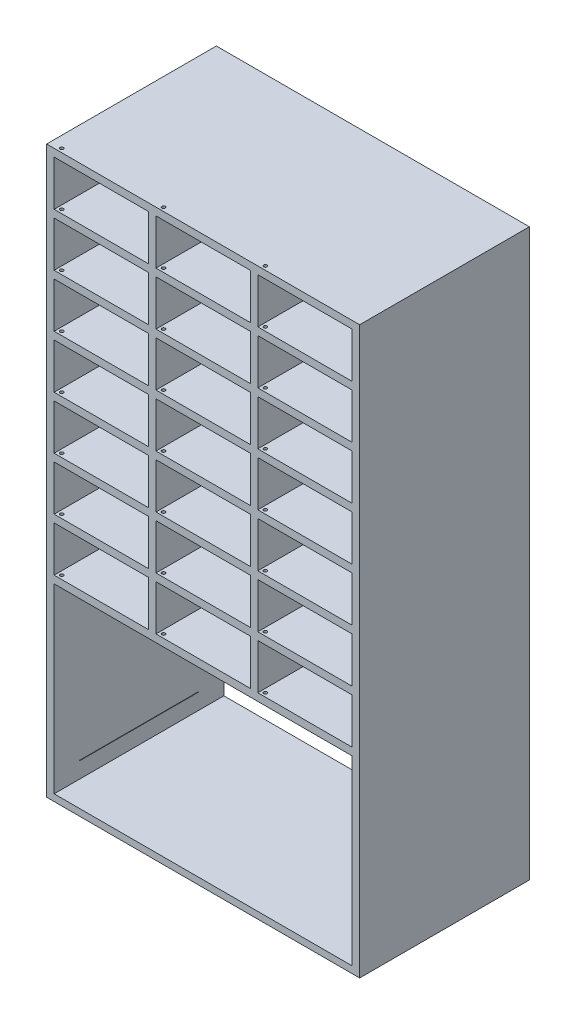
from build123d import *

# Parameters (mm, degrees)
SKETCH1_W                      = 560
SKETCH1_H                      = 450
BOSS_EXTRUDE1_DEPTH            = 20
SKETCH3_W                      = 20
SKETCH3_H                      = 450
BOSS_EXTRUDE2_DEPTH            = 120
LPATTERN2_COUNT                = 7
LPATTERN2_PITCH                = 140
LPATTERN5_COUNT                = 2
LPATTERN5_PITCH                = 270
LPATTERN5_COUNT_DIR2           = 14
LPATTERN5_PITCH_DIR2           = 140
SKETCH6_W                      = 450
SKETCH6_H                      = 1000
BOSS_EXTRUDE5_DEPTH            = 20
BOSS_EXTRUDE6_DEPTH            = 450
CUT_EXTRUDE1_REACH             = 1486.158
SKETCH10_R                     = 4.4
CUT_EXTRUDE1_DIRECTION_2_REACH = 1486.158
LPATTERN6_COUNT                = 3
LPATTERN6_PITCH                = 270
SKETCH13_W                     = 315
SKETCH13_H                     = 1.2
CUT_EXTRUDE3_DEPTH             = 20


with BuildPart() as part:
    # Sketch1 → Boss-Extrude1 (new body)
    with BuildSketch(Plane(origin=(0, 0, 0), x_dir=(1, 0, 0), z_dir=(0, 1, 0))):
        Rectangle(SKETCH1_W, SKETCH1_H)
    boss_extrude1 = extrude(amount=BOSS_EXTRUDE1_DEPTH)

    # Sketch3 → Boss-Extrude2 (add)
    with BuildSketch(Plane(origin=(0, 20, 0), x_dir=(1, 0, 0), z_dir=(0, 1, 0))):
        with Locations((-270, 0)):
            Rectangle(SKETCH3_W, SKETCH3_H)
        Rectangle(SKETCH3_W, SKETCH3_H)
        with Locations((270, 0)):
            Rectangle(SKETCH3_W, SKETCH3_H)
    extrude(amount=BOSS_EXTRUDE2_DEPTH)


with BuildPart() as lpattern2_1:
    # LPattern2: pattern copy
    add(part.part.moved(Location(Vector(0, 1, 0) * (1 * LPATTERN2_PITCH))))


with BuildPart() as lpattern2_2:
    # LPattern2: pattern copy
    add(part.part.moved(Location(Vector(0, 1, 0) * (2 * LPATTERN2_PITCH))))


with BuildPart() as lpattern2_3:
    # LPattern2: pattern copy
    add(part.part.moved(Location(Vector(0, 1, 0) * (3 * LPATTERN2_PITCH))))


with BuildPart() as lpattern2_4:
    # LPattern2: pattern copy
    add(part.part.moved(Location(Vector(0, 1, 0) * (4 * LPATTERN2_PITCH))))


with BuildPart() as lpattern2_5:
    # LPattern2: pattern copy
    add(part.part.moved(Location(Vector(0, 1, 0) * (5 * LPATTERN2_PITCH))))


with BuildPart() as lpattern2_6:
    # LPattern2: pattern copy
    add(part.part.moved(Location(Vector(0, 1, 0) * (6 * LPATTERN2_PITCH))))


with BuildPart() as lpattern5_1:
    # LPattern5: pattern copy
    add(boss_extrude1.moved(Location(Vector(1, 0, 0) * (0 * LPATTERN5_PITCH) + Vector(0, 1, 0) * (1 * LPATTERN5_PITCH_DIR2))))


with BuildPart() as lpattern5_2:
    # LPattern5: pattern copy
    add(boss_extrude1.moved(Location(Vector(1, 0, 0) * (0 * LPATTERN5_PITCH) + Vector(0, 1, 0) * (2 * LPATTERN5_PITCH_DIR2))))


with BuildPart() as lpattern5_3:
    # LPattern5: pattern copy
    add(boss_extrude1.moved(Location(Vector(1, 0, 0) * (0 * LPATTERN5_PITCH) + Vector(0, 1, 0) * (3 * LPATTERN5_PITCH_DIR2))))


with BuildPart() as lpattern5_4:
    # LPattern5: pattern copy
    add(boss_extrude1.moved(Location(Vector(1, 0, 0) * (0 * LPATTERN5_PITCH) + Vector(0, 1, 0) * (4 * LPATTERN5_PITCH_DIR2))))


with BuildPart() as lpattern5_5:
    # LPattern5: pattern copy
    add(boss_extrude1.moved(Location(Vector(1, 0, 0) * (0 * LPATTERN5_PITCH) + Vector(0, 1, 0) * (5 * LPATTERN5_PITCH_DIR2))))


with BuildPart() as lpattern5_6:
    # LPattern5: pattern copy
    add(boss_extrude1.moved(Location(Vector(1, 0, 0) * (0 * LPATTERN5_PITCH) + Vector(0, 1, 0) * (6 * LPATTERN5_PITCH_DIR2))))


with BuildPart() as lpattern5_7:
    # LPattern5: pattern copy
    add(boss_extrude1.moved(Location(Vector(1, 0, 0) * (0 * LPATTERN5_PITCH) + Vector(0, 1, 0) * (7 * LPATTERN5_PITCH_DIR2))))


with BuildPart() as lpattern5_8:
    # LPattern5: pattern copy
    add(boss_extrude1.moved(Location(Vector(1, 0, 0) * (1 * LPATTERN5_PITCH) + Vector(0, 1, 0) * (0 * LPATTERN5_PITCH_DIR2))))


with BuildPart() as lpattern5_9:
    # LPattern5: pattern copy
    add(boss_extrude1.moved(Location(Vector(1, 0, 0) * (1 * LPATTERN5_PITCH) + Vector(0, 1, 0) * (1 * LPATTERN5_PITCH_DIR2))))


with BuildPart() as lpattern5_10:
    # LPattern5: pattern copy
    add(boss_extrude1.moved(Location(Vector(1, 0, 0) * (1 * LPATTERN5_PITCH) + Vector(0, 1, 0) * (2 * LPATTERN5_PITCH_DIR2))))


with BuildPart() as lpattern5_11:
    # LPattern5: pattern copy
    add(boss_extrude1.moved(Location(Vector(1, 0, 0) * (1 * LPATTERN5_PITCH) + Vector(0, 1, 0) * (3 * LPATTERN5_PITCH_DIR2))))


with BuildPart() as lpattern5_12:
    # LPattern5: pattern copy
    add(boss_extrude1.moved(Location(Vector(1, 0, 0) * (1 * LPATTERN5_PITCH) + Vector(0, 1, 0) * (4 * LPATTERN5_PITCH_DIR2))))


with BuildPart() as lpattern5_13:
    # LPattern5: pattern copy
    add(boss_extrude1.moved(Location(Vector(1, 0, 0) * (1 * LPATTERN5_PITCH) + Vector(0, 1, 0) * (5 * LPATTERN5_PITCH_DIR2))))


with BuildPart() as lpattern5_14:
    # LPattern5: pattern copy
    add(boss_extrude1.moved(Location(Vector(1, 0, 0) * (1 * LPATTERN5_PITCH) + Vector(0, 1, 0) * (6 * LPATTERN5_PITCH_DIR2))))


with BuildPart() as lpattern5_15:
    # LPattern5: pattern copy
    add(boss_extrude1.moved(Location(Vector(1, 0, 0) * (1 * LPATTERN5_PITCH) + Vector(0, 1, 0) * (7 * LPATTERN5_PITCH_DIR2))))


with BuildPart() as part_1:
    add(part.part)

    # LPattern5 united with what the copies to: union LPattern2_1, LPattern2_2, LPattern2_3, LPattern2_4, LPattern2_5, LPattern2_6, LPattern5_1, LPattern5_2, LPattern5_3, LPattern5_4, LPattern5_5, LPattern5_6, LPattern5_7, LPattern5_8, LPattern5_9, LPattern5_10, LPattern5_11, LPattern5_12, LPattern5_13, LPattern5_14, LPattern5_15
    add(lpattern2_1.part)
    add(lpattern2_2.part)
    add(lpattern2_3.part)
    add(lpattern2_4.part)
    add(lpattern2_5.part)
    add(lpattern2_6.part)
    add(lpattern5_1.part)
    add(lpattern5_2.part)
    add(lpattern5_3.part)
    add(lpattern5_4.part)
    add(lpattern5_5.part)
    add(lpattern5_6.part)
    add(lpattern5_7.part)
    add(lpattern5_8.part)
    add(lpattern5_9.part)
    add(lpattern5_10.part)
    add(lpattern5_11.part)
    add(lpattern5_12.part)
    add(lpattern5_13.part)
    add(lpattern5_14.part)
    add(lpattern5_15.part)

    # Sketch6 → Boss-Extrude5 (add)
    with BuildSketch(Plane(origin=(550, 0, 0), x_dir=(0, 0, -1), z_dir=(1, 0, 0))):
        with Locations((0, 500)):
            Rectangle(SKETCH6_W, SKETCH6_H)
    extrude(amount=-BOSS_EXTRUDE5_DEPTH)

    # Sketch9 → Boss-Extrude6 (add)
    with BuildSketch(Plane.XY.offset(225)):
        Polygon((-260, -482.101596541), (-260, 0), (-280, 0), (-280, -500), (550, -500), (550, 0), (530, 0), (530, -482.101596541), align=None)
    extrude(amount=-BOSS_EXTRUDE6_DEPTH)

    # Cut-Extrude1: up to this face of the body (flat: up to its plane)
    cut_extrude1_end = Plane(part_1.part.faces().sort_by_distance((135, 1000, 0))[0])
    # Sketch10 → Cut-Extrude1 (cut, up to the picked face)
    with BuildSketch(Plane(origin=(0, 860, 0), x_dir=(1, 0, 0), z_dir=(0, 1, 0)), mode=Mode.PRIVATE) as cut_extrude1_sk1:
        with Locations(Location((-250, -215, 0), (0, 0, 270))):
            Circle(SKETCH10_R)
    cut_extrude1_tool1 = split(extrude(cut_extrude1_sk1.sketch, amount=CUT_EXTRUDE1_REACH, mode=Mode.PRIVATE), bisect_by=cut_extrude1_end, keep=Keep.BOTH, mode=Mode.PRIVATE)
    cut_extrude1 = cut_extrude1_tool1.solids().sort_by(Axis((-250, 860, 215), (0, 1, 0)))[0]
    add(cut_extrude1, mode=Mode.SUBTRACT)

    # Cut-Extrude1 direction 2: up to this face of the body (flat: up to its plane)
    cut_extrude1_direction_2_end = Plane(part_1.part.faces().sort_by_distance((135, 0, 0))[0])
    # Sketch10 → Cut-Extrude1 direction 2 (cut, up to the picked face)
    with BuildSketch(Plane(origin=(0, 860, 0), x_dir=(1, 0, 0), z_dir=(0, 1, 0)), mode=Mode.PRIVATE) as cut_extrude1_direction_2_sk1:
        with Locations(Location((-250, -215, 0), (0, 0, 270))):
            Circle(SKETCH10_R)
    cut_extrude1_direction_2_tool1 = split(extrude(cut_extrude1_direction_2_sk1.sketch, amount=-CUT_EXTRUDE1_DIRECTION_2_REACH, mode=Mode.PRIVATE), bisect_by=cut_extrude1_direction_2_end, keep=Keep.BOTH, mode=Mode.PRIVATE)
    cut_extrude1_direction_2 = cut_extrude1_direction_2_tool1.solids().sort_by(Axis((-250, 860, 215), (0, -1, 0)))[0]
    add(cut_extrude1_direction_2, mode=Mode.SUBTRACT)

    # LPattern6: Cut-Extrude1, Cut-Extrude1 direction 2 ×3
    with Locations(*[(i * LPATTERN6_PITCH, 0, 0) for i in range(1, LPATTERN6_COUNT)]):
        add(cut_extrude1, mode=Mode.SUBTRACT)
        add(cut_extrude1_direction_2, mode=Mode.SUBTRACT)

    # Sketch13 → Cut-Extrude3 (cut)
    with BuildSketch(Plane.ZY.offset(280)):
        with Locations((0, -439.4)):
            Rectangle(SKETCH13_W, SKETCH13_H)
    extrude(amount=-CUT_EXTRUDE3_DEPTH, mode=Mode.SUBTRACT)


solid = part_1.part
